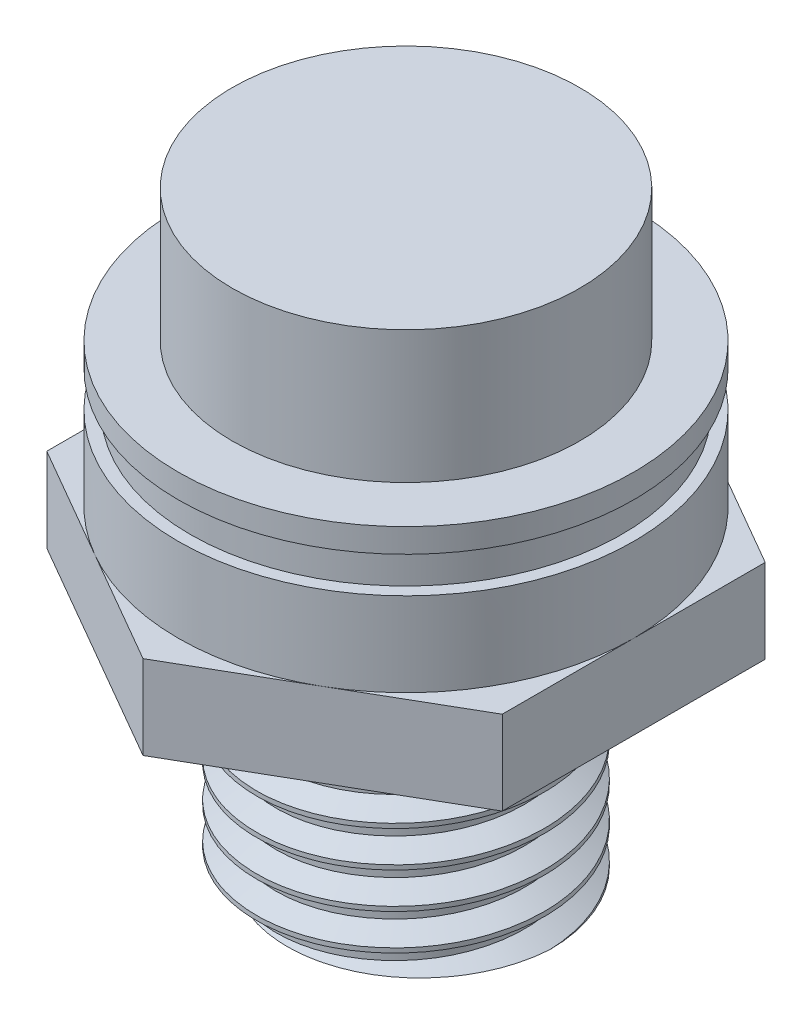
from build123d import *

# Parameters (mm, degrees)
BOSS_EXTRUDE1_DEPTH = 3.5
SKETCH2_R           = 9.5
BOSS_EXTRUDE2_DEPTH = 3.5
SKETCH3_R           = 9
BOSS_EXTRUDE3_DEPTH = 1.5
SKETCH4_R           = 9.5
BOSS_EXTRUDE4_DEPTH = 1
SKETCH5_R           = 7.25
BOSS_EXTRUDE5_DEPTH = 5.52
SKETCH6_R           = 6
BOSS_EXTRUDE6_DEPTH = 9.5
SKETCH14_R          = 6
SKETCH14_R_2        = 4.5
CUT_EXTRUDE1_DEPTH  = 1.5
THREAD1_PITCH       = 1.5


with BuildPart() as part:
    # Sketch1 → Boss-Extrude1 (new body)
    with BuildSketch(Plane(origin=(0, 0, 0), x_dir=(1, 0, 0), z_dir=(0, 1, 0))):
        Polygon((0, 10.969655115), (-9.5, 5.484827557), (-9.5, -5.484827557), (0, -10.969655115), (9.5, -5.484827557), (9.5, 5.484827557), align=None)
    extrude(amount=BOSS_EXTRUDE1_DEPTH)

    # Sketch2 → Boss-Extrude2 (add)
    with BuildSketch(Plane(origin=(0, 3.5, 0), x_dir=(1, 0, 0), z_dir=(0, 1, 0))):
        with Locations(Location((0, 0, 0), (0, 0, 60))):
            Circle(SKETCH2_R)
    extrude(amount=BOSS_EXTRUDE2_DEPTH)

    # Sketch3 → Boss-Extrude3 (add)
    with BuildSketch(Plane(origin=(0, 7, 0), x_dir=(1, 0, 0), z_dir=(0, 1, 0))):
        with Locations(Location((0, 0, 0), (0, 0, 270))):
            Circle(SKETCH3_R)
    extrude(amount=BOSS_EXTRUDE3_DEPTH)

    # Sketch4 → Boss-Extrude4 (add)
    with BuildSketch(Plane(origin=(0, 8.5, 0), x_dir=(1, 0, 0), z_dir=(0, 1, 0))):
        with Locations(Location((0, 0, 0), (0, 0, 60))):
            Circle(SKETCH4_R)
    extrude(amount=BOSS_EXTRUDE4_DEPTH)

    # Sketch5 → Boss-Extrude5 (add)
    with BuildSketch(Plane(origin=(0, 9.5, 0), x_dir=(1, 0, 0), z_dir=(0, 1, 0))):
        with Locations(Location((0, 0, 0), (0, 0, 270))):
            Circle(SKETCH5_R)
    extrude(amount=BOSS_EXTRUDE5_DEPTH)

    # Sketch6 → Boss-Extrude6 (add)
    with BuildSketch(Plane.XZ):
        with Locations(Location((0, 0, 0), (0, 0, 270))):
            Circle(SKETCH6_R)
    extrude(amount=BOSS_EXTRUDE6_DEPTH)

    # Sketch14 → Cut-Extrude1 (cut)
    with BuildSketch(Plane.XZ):
        with Locations(Location((0, 0, 0), (0, 0, 270))):
            Circle(SKETCH14_R)
        with Locations(Location((0, 0, 0), (0, 0, 270))):
            Circle(SKETCH14_R_2, mode=Mode.SUBTRACT)
    extrude(amount=CUT_EXTRUDE1_DEPTH, mode=Mode.SUBTRACT)

    # Thread1: the profile of Thread Profile3 profile screwed along a right-hand helix of 6.333333 turns, 8 arcs to a turn; built about Z, then put on its axis
    thread1_z = Axis((0, 0, 0), (0, 0, 1))
    thread1_corners = [(6.0003, 0, -0.000173205), (6.0003, 0, 1.312673201), (5.188101188, 0, 0.843749998), (5.188101188, 0, 0.468749998)]
    with BuildLine(mode=Mode.PRIVATE) as thread1_profile:
        Line(thread1_corners[0], thread1_corners[1])
        Line(thread1_corners[1], thread1_corners[2])
        Line(thread1_corners[2], thread1_corners[3])
        Line(thread1_corners[3], thread1_corners[0])
    thread1_cap = Face(thread1_profile.wire())
    thread1_turn_angles = [0, 22.5, 45, 67.5, 90, 112.5, 135, 157.5, 180, 202.5, 225, 247.5, 270, 292.5, 315, 337.5, 360]
    thread1_turn_weights = [1, 0.9238795325112867, 1, 0.9238795325112867, 1, 0.9238795325112867, 1, 0.9238795325112867, 1, 0.9238795325112867, 1, 0.9238795325112867, 1, 0.9238795325112867, 1, 0.9238795325112867, 1]
    thread1_turn_rails = [Edge.make_bspline([Vector(p[0], p[1], 0).rotate(thread1_z, thread1_turn_angles[k]) / thread1_turn_weights[k] + Vector(0, 0, p[2] + THREAD1_PITCH * thread1_turn_angles[k] / 360) for k in range(17)], [0, 0, 0, 1, 1, 2, 2, 3, 3, 4, 4, 5, 5, 6, 6, 7, 7, 8, 8, 8], 2, thread1_turn_weights) for p in thread1_corners]
    thread1_turn_sides = [Face.make_surface_from_curves(thread1_turn_rails[p[0]], thread1_turn_rails[p[1]]) for p in [(0, 1), (1, 2), (2, 3), (3, 0)]]
    thread1_last_angles = [2160, 2182.5, 2205, 2227.5, 2250, 2265, 2280]
    thread1_last_weights = [1, 0.9238795325112867, 1, 0.9238795325112867, 1, 0.9659258262890693, 1]
    thread1_last_rails = [Edge.make_bspline([Vector(p[0], p[1], 0).rotate(thread1_z, thread1_last_angles[k]) / thread1_last_weights[k] + Vector(0, 0, p[2] + THREAD1_PITCH * thread1_last_angles[k] / 360) for k in range(7)], [0, 0, 0, 1, 1, 2, 2, 3, 3, 3], 2, thread1_last_weights) for p in thread1_corners]
    thread1_last_sides = [Face.make_surface_from_curves(thread1_last_rails[p[0]], thread1_last_rails[p[1]]) for p in [(0, 1), (1, 2), (2, 3), (3, 0)]]
    thread1 = Plane(origin=(0, -11, 0), x_dir=(1, 0, 0), z_dir=(0, 1, 0)) * Solid(Shell([*[p.moved(Location((0, 0, THREAD1_PITCH * i))) for i in range(6) for p in thread1_turn_sides], *thread1_last_sides, thread1_cap, thread1_cap.rotate(thread1_z, 2280).moved(Location((0, 0, THREAD1_PITCH * 2280 / 360)))]))
    add(thread1, mode=Mode.SUBTRACT)


solid = part.part
